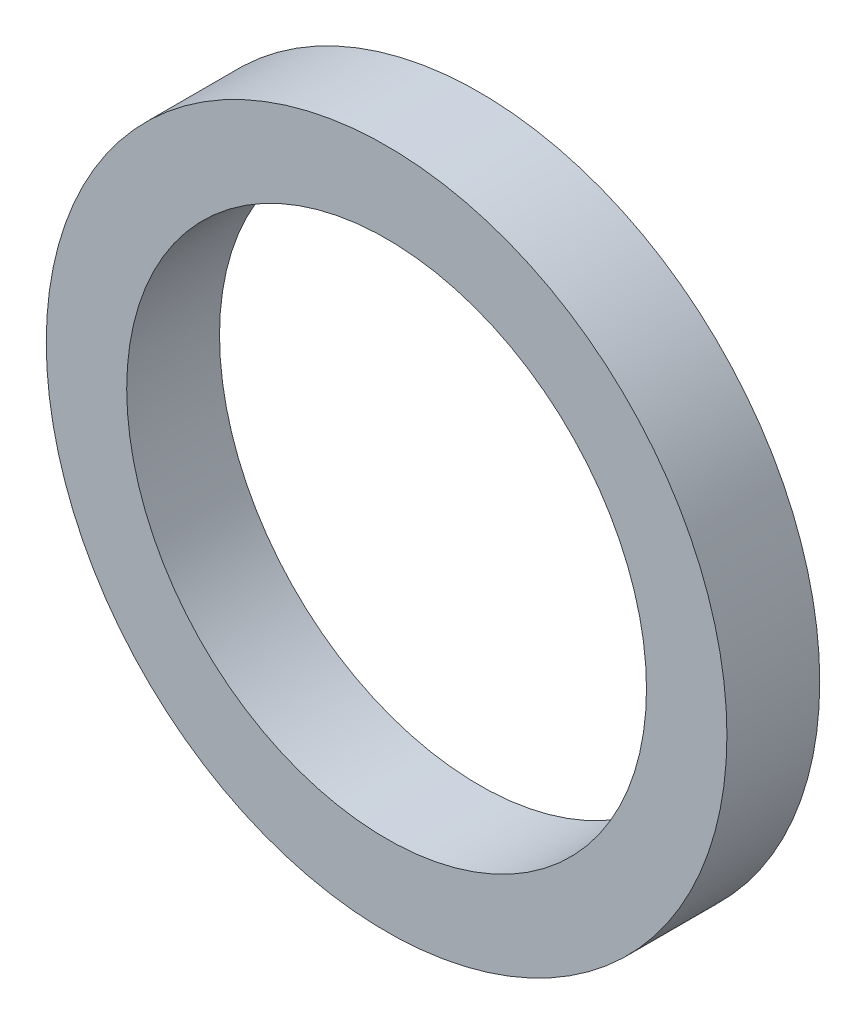
from build123d import *

# Parameters (mm, degrees)
BOSS_EXTRUDE1_START     = 10.5
SKETCH1_R               = 5.5
BOSS_EXTRUDE1_DEPTH     = 1.5
CUT_EXTRUDE1_DEPTH      = 15.300349646
CUT_EXTRUDE1_DEPTH_BACK = 15.300349646
SKETCH2_R               = 4.2


with BuildPart() as part:
    # Sketch1 → Boss-Extrude1 (new body)
    with BuildSketch(Plane.XY.offset(BOSS_EXTRUDE1_START)):
        Circle(SKETCH1_R)
    extrude(amount=BOSS_EXTRUDE1_DEPTH)

    # Sketch2 → Cut-Extrude1 (cut, two sides: drawn at the far end of the back side and taken through both)
    with BuildSketch(Plane.XY.offset(-CUT_EXTRUDE1_DEPTH_BACK)):
        Circle(SKETCH2_R)
    extrude(amount=CUT_EXTRUDE1_DEPTH + CUT_EXTRUDE1_DEPTH_BACK, mode=Mode.SUBTRACT)


solid = part.part
